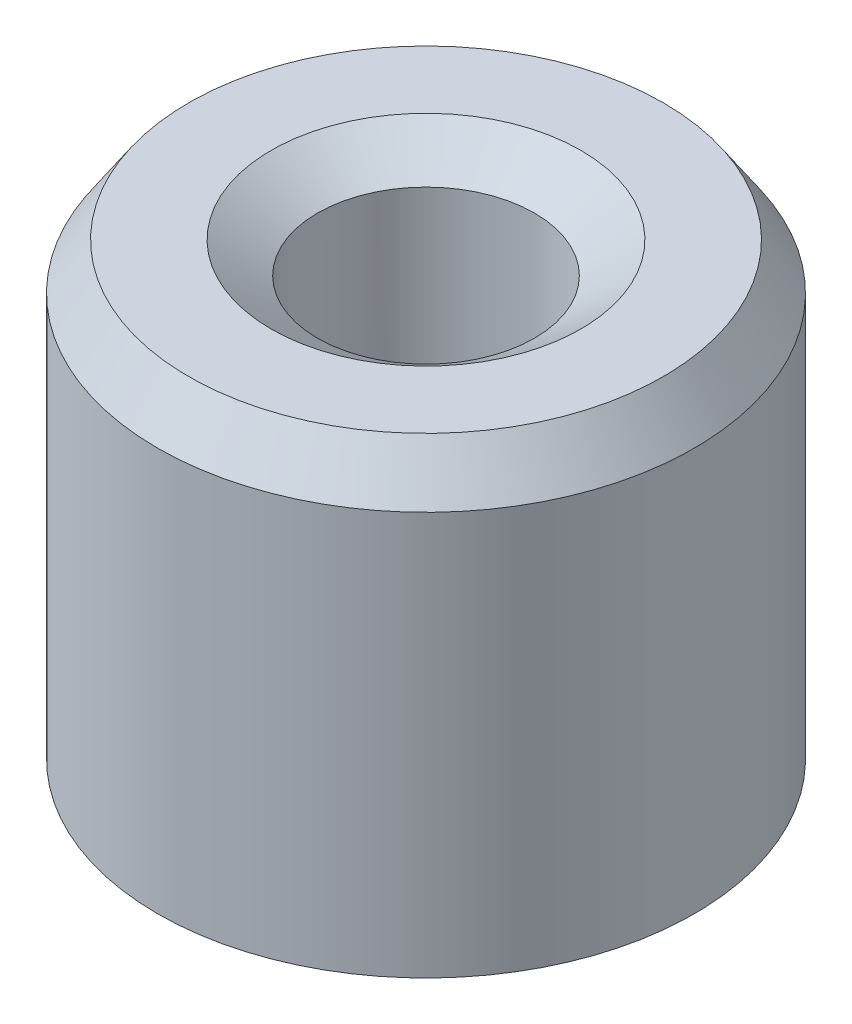
from build123d import *
from OCP.BRepFilletAPI import BRepFilletAPI_MakeChamfer

# Parameters (mm, degrees)
SKETCH1_R           = 5
BOSS_EXTRUDE1_DEPTH = 8.957908471
SKETCH2_R           = 2.020582019
CUT_EXTRUDE1_DEPTH  = 12.412454783
CHAMFER1_SIZE       = 0.863822531
CHAMFER1_SIZE2      = 0.580103188


with BuildPart() as part:
    # Sketch1 → Boss-Extrude1 (new body)
    with BuildSketch(Plane(origin=(0, 0, 0), x_dir=(1, 0, 0), z_dir=(0, 1, 0))):
        Circle(SKETCH1_R)
    extrude(amount=BOSS_EXTRUDE1_DEPTH)

    # Sketch2 → Cut-Extrude1 (cut, through all)
    with BuildSketch(Plane(origin=(0, 0, 0), x_dir=(1, 0, 0), z_dir=(0, 1, 0))):
        Circle(SKETCH2_R)
    extrude(amount=CUT_EXTRUDE1_DEPTH, mode=Mode.SUBTRACT)

    # Chamfer1: one chamfer whose edges measure the first distance from different faces: ONE call of the kernel's chamfer builder (chamfer() names one face for all edges)
    chamfer1_edges_1 = [part.edges().sort_by_distance(p)[0] for p in [
        (-2.020582019, 8.957908471, 0),
    ]]
    chamfer1_side_1 = [part.faces().sort_by_distance(p)[0] for p in [
        (-4.858578644, 8.957908471, 0),
    ]]
    chamfer1_edges_2 = [part.edges().sort_by_distance(p)[0] for p in [
        (-2.020582019, 0, 0),
    ]]
    chamfer1_side_2 = [part.faces().sort_by_distance(p)[0] for p in [
        (-2.020582019, 4.478954235, 0),
    ]]
    chamfer1_edges_3 = [part.edges().sort_by_distance(p)[0] for p in [
        (-5, 0, 0),
    ]]
    chamfer1_side_3 = [part.faces().sort_by_distance(p)[0] for p in [
        (-4.858578644, 0, 0),
    ]]
    chamfer1_edges_4 = [part.edges().sort_by_distance(p)[0] for p in [
        (-5, 8.957908471, 0),
    ]]
    chamfer1_side_4 = [part.faces().sort_by_distance(p)[0] for p in [
        (-5, 4.478954235, 0),
    ]]
    chamfer1 = BRepFilletAPI_MakeChamfer(part.part.solid().wrapped)
    for e in chamfer1_edges_1:
        chamfer1.Add(CHAMFER1_SIZE, CHAMFER1_SIZE2, e.wrapped, chamfer1_side_1[0].wrapped)  # the first distance lies on this face
    for e in chamfer1_edges_2:
        chamfer1.Add(CHAMFER1_SIZE, CHAMFER1_SIZE2, e.wrapped, chamfer1_side_2[0].wrapped)  # the first distance lies on this face
    for e in chamfer1_edges_3:
        chamfer1.Add(CHAMFER1_SIZE, CHAMFER1_SIZE2, e.wrapped, chamfer1_side_3[0].wrapped)  # the first distance lies on this face
    for e in chamfer1_edges_4:
        chamfer1.Add(CHAMFER1_SIZE, CHAMFER1_SIZE2, e.wrapped, chamfer1_side_4[0].wrapped)  # the first distance lies on this face
    add(Compound.cast(chamfer1.Shape()), mode=Mode.REPLACE)


solid = part.part
